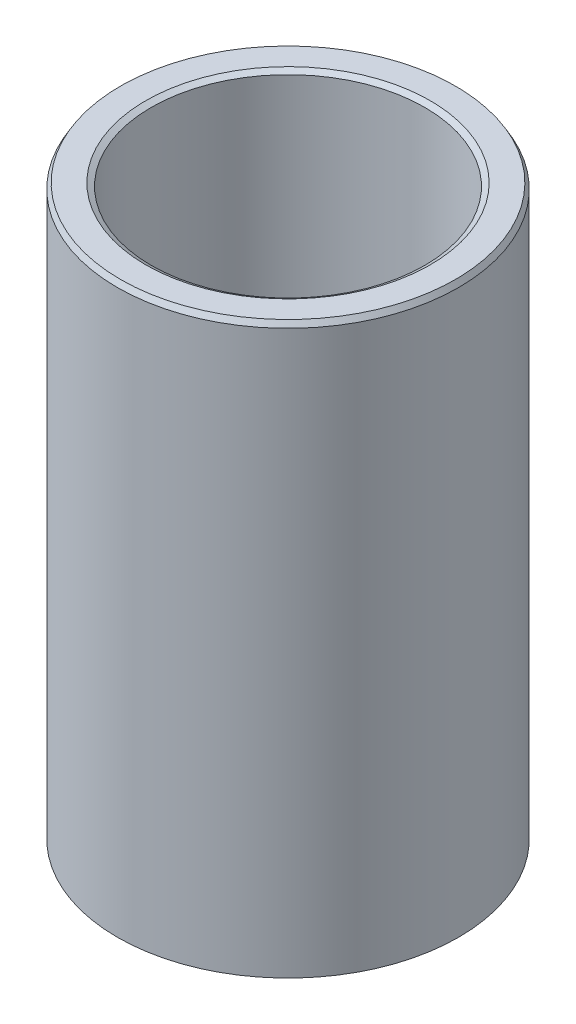
from build123d import *
from OCP.BRepFilletAPI import BRepFilletAPI_MakeChamfer

# Parameters (mm, degrees)
SKETCH1_R           = 47.5
BOSS_EXTRUDE1_DEPTH = 159.028613574
SKETCH2_R           = 38.089516142
CUT_EXTRUDE1_DEPTH  = 173.634295362
CHAMFER1_SIZE       = 1.508389988
CHAMFER1_SIZE2      = 0.870869366


with BuildPart() as part:
    # Sketch1 → Boss-Extrude1 (new body)
    with BuildSketch(Plane(origin=(0, 0, 0), x_dir=(1, 0, 0), z_dir=(0, 1, 0))):
        Circle(SKETCH1_R)
    extrude(amount=BOSS_EXTRUDE1_DEPTH)

    # Sketch2 → Cut-Extrude1 (cut, through all)
    with BuildSketch(Plane(origin=(0, 0, 0), x_dir=(1, 0, 0), z_dir=(0, 1, 0))):
        Circle(SKETCH2_R)
    extrude(amount=CUT_EXTRUDE1_DEPTH, mode=Mode.SUBTRACT)

    # Chamfer1: one chamfer whose edges measure the first distance from different faces: ONE call of the kernel's chamfer builder (chamfer() names one face for all edges)
    chamfer1_edges_1 = [part.edges().sort_by_distance(p)[0] for p in [
        (-38.089516142, 159.028613574, 0),
    ]]
    chamfer1_side_1 = [part.faces().sort_by_distance(p)[0] for p in [
        (-46.156497116, 159.028613574, 0),
    ]]
    chamfer1_edges_2 = [part.edges().sort_by_distance(p)[0] for p in [
        (-38.089516142, 0, 0),
    ]]
    chamfer1_side_2 = [part.faces().sort_by_distance(p)[0] for p in [
        (-38.089516142, 79.514306787, 0),
    ]]
    chamfer1_edges_3 = [part.edges().sort_by_distance(p)[0] for p in [
        (-47.5, 0, 0),
    ]]
    chamfer1_side_3 = [part.faces().sort_by_distance(p)[0] for p in [
        (-46.156497116, 0, 0),
    ]]
    chamfer1_edges_4 = [part.edges().sort_by_distance(p)[0] for p in [
        (-47.5, 159.028613574, 0),
    ]]
    chamfer1_side_4 = [part.faces().sort_by_distance(p)[0] for p in [
        (-47.5, 79.514306787, 0),
    ]]
    chamfer1 = BRepFilletAPI_MakeChamfer(part.part.solid().wrapped)
    for e in chamfer1_edges_1:
        chamfer1.Add(CHAMFER1_SIZE, CHAMFER1_SIZE2, e.wrapped, chamfer1_side_1[0].wrapped)  # the first distance lies on this face
    for e in chamfer1_edges_2:
        chamfer1.Add(CHAMFER1_SIZE, CHAMFER1_SIZE2, e.wrapped, chamfer1_side_2[0].wrapped)  # the first distance lies on this face
    for e in chamfer1_edges_3:
        chamfer1.Add(CHAMFER1_SIZE, CHAMFER1_SIZE2, e.wrapped, chamfer1_side_3[0].wrapped)  # the first distance lies on this face
    for e in chamfer1_edges_4:
        chamfer1.Add(CHAMFER1_SIZE, CHAMFER1_SIZE2, e.wrapped, chamfer1_side_4[0].wrapped)  # the first distance lies on this face
    add(Compound.cast(chamfer1.Shape()), mode=Mode.REPLACE)


solid = part.part
